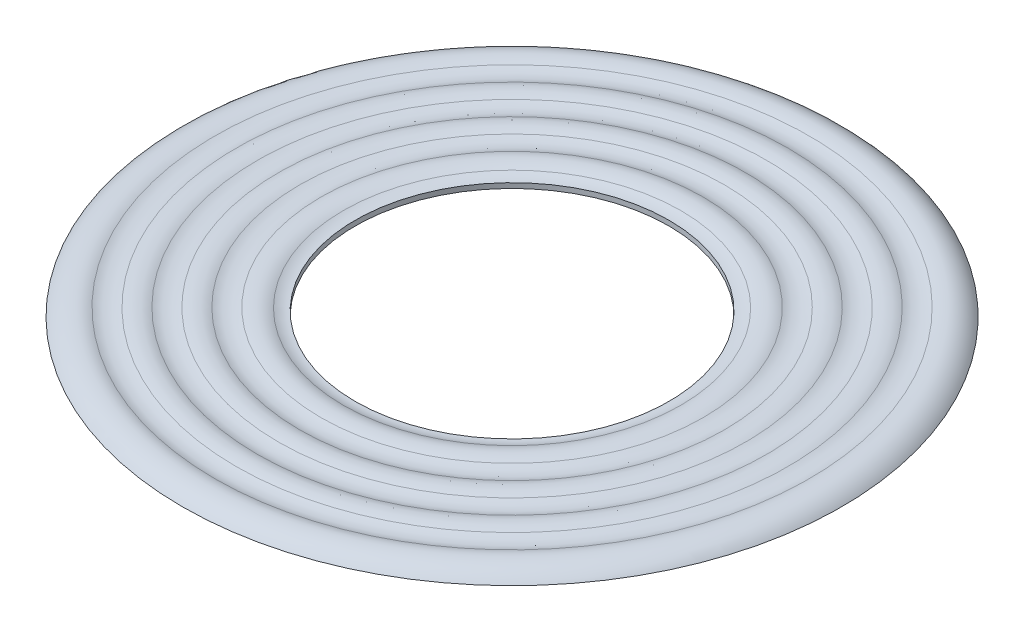
from build123d import *


# Read off the part's stored shape, not the designer's step: Shell1
with BuildPart() as part:
    # Sketch1 → Revolve1 (revolve)
    with BuildSketch(Plane.XY, mode=Mode.PRIVATE) as revolve1_sk:
        with BuildLine():
            Line((-33.3375, -0.508), (-15.875, -0.508))
            Line((-15.875, -0.508), (-15.875, 0))
            ThreePointArc((-15.875, 0), (-16.484742306, 0.064204054), (-17.067739167, 0.254))
            ThreePointArc((-17.067739167, 0.254), (-18.194819496, 0.507263586), (-19.332123768, 0.3048))
            ThreePointArc((-19.332123768, 0.3048), (-20.403769202, 0.1016), (-21.475414637, 0.3048))
            ThreePointArc((-21.475414637, 0.3048), (-22.547060071, 0.508), (-23.618705505, 0.3048))
            ThreePointArc((-23.618705505, 0.3048), (-24.690350939, 0.1016), (-25.761996373, 0.3048))
            ThreePointArc((-25.761996373, 0.3048), (-26.833641807, 0.508), (-27.905287241, 0.3048))
            ThreePointArc((-27.905287241, 0.3048), (-28.976932676, 0.1016), (-30.04857811, 0.3048))
            ThreePointArc((-30.04857811, 0.3048), (-31.822561475, 0.422500791), (-33.3375, -0.508))
        make_face()
    revolve(revolve1_sk.sketch.rotate(Axis((0, 27.311018835, 0), (0, -1, 0)), 270), axis=Axis((0, 27.311018835, 0), (0, -1, 0)))

    # Shell1 outline → Shell1 (revolve, cut)
    with BuildSketch(Plane.XY):
        with BuildLine():
            ThreePointArc((17.316110519, -0.302708031), (17.020995547, -0.41880395), (16.716668134, -0.508))
            Line((16.716668134, -0.508), (20.403769203, -0.508))
            ThreePointArc((20.403769203, -0.508), (19.744833362, -0.44607961), (19.108968503, -0.262486425))
            ThreePointArc((19.108968503, -0.262486425), (18.208492036, -0.102183066), (17.316110519, -0.302708031))
        make_face()
        with BuildLine():
            ThreePointArc((21.698569902, -0.262486425), (21.062705043, -0.44607961), (20.403769203, -0.508))
            Line((20.403769203, -0.508), (24.690350939, -0.508))
            ThreePointArc((24.690350939, -0.508), (24.031415098, -0.44607961), (23.395550239, -0.262486425))
            ThreePointArc((23.395550239, -0.262486425), (22.54706007, -0.1016), (21.698569902, -0.262486425))
        make_face()
        with BuildLine():
            ThreePointArc((25.985151639, -0.262486425), (25.34928678, -0.44607961), (24.690350939, -0.508))
            Line((24.690350939, -0.508), (28.976932676, -0.508))
            ThreePointArc((28.976932676, -0.508), (28.317996835, -0.44607961), (27.682131976, -0.262486425))
            ThreePointArc((27.682131976, -0.262486425), (26.833641808, -0.1016), (25.985151639, -0.262486425))
        make_face()
        with BuildLine():
            ThreePointArc((30.271733375, -0.262486425), (29.635868516, -0.44607961), (28.976932676, -0.508))
            Line((28.976932676, -0.508), (32.431247767, -0.508))
            ThreePointArc((32.431247767, -0.508), (31.382051095, -0.116435704), (30.271733375, -0.262486425))
        make_face()
    revolve(axis=Axis((0, 0, 0), (0, 1, 0)), mode=Mode.SUBTRACT)


solid = part.part
